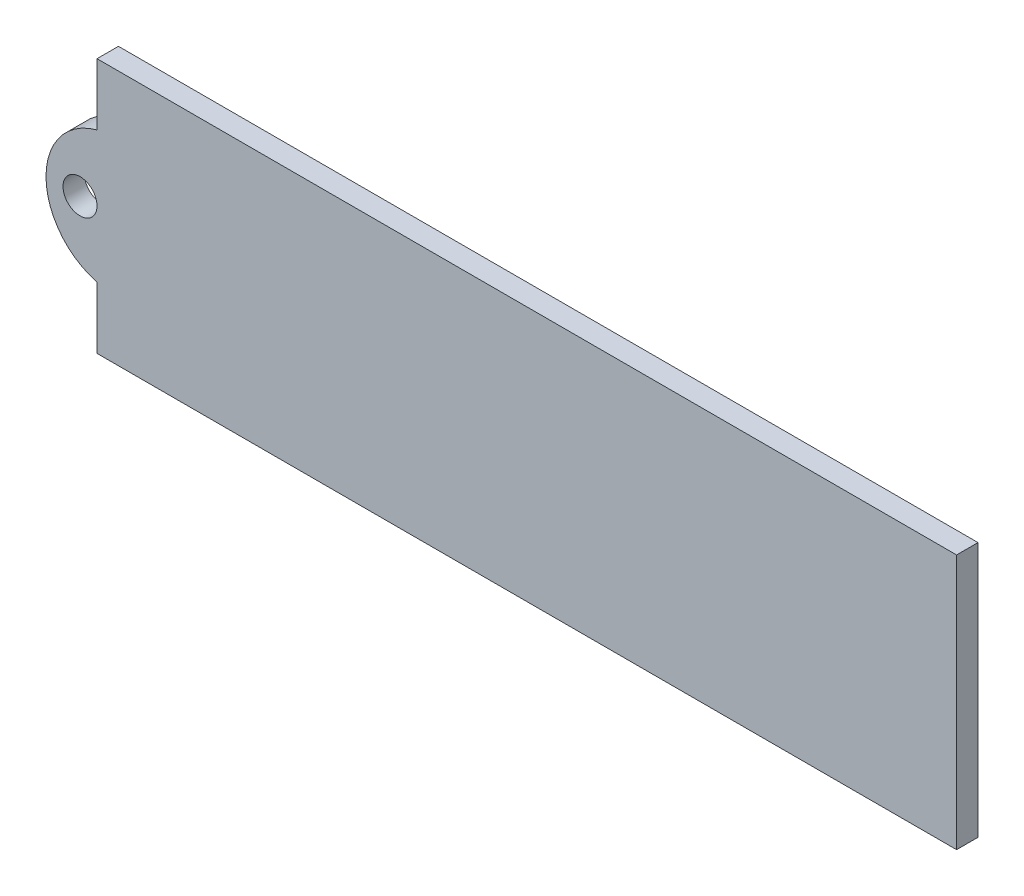
from build123d import *

# Parameters (mm, degrees)
BOSS_EXTRUDE1_DEPTH = 2
CUT_EXTRUDE1_DEPTH  = 2.54


with BuildPart() as part:
    # Sketch2 → Boss-Extrude1 (new body)
    with BuildSketch(Plane.XY):
        with BuildLine():
            Line((-40.11295, 11.9126), (-40.11295, 6.148361062))
            ThreePointArc((-40.11295, 6.148361062), (-44.87545, 0), (-40.11295, -6.148361062))
            Line((-40.11295, -6.148361062), (-40.11295, -11.9126))
            Line((-40.11295, -11.9126), (40.11295, -11.9126))
            Line((40.11295, -11.9126), (40.11295, 11.9126))
            Line((40.11295, 11.9126), (-40.11295, 11.9126))
        make_face()
    extrude(amount=BOSS_EXTRUDE1_DEPTH)

    # Sketch5 → Cut-Extrude1 (cut)
    with BuildSketch(Plane(origin=(0, 0, 0), x_dir=(-1, 0, 0), z_dir=(0, 0, -1))):
        with BuildLine():
            ThreePointArc((41.70045, -1.5875), (42.494200012, -1.374815321), (43.075265343, -0.793749976))
            ThreePointArc((43.075265343, -0.793749976), (43.233857253, -0.41087522), (43.28795, 0))
            ThreePointArc((43.28795, 0), (43.233857248, 0.410875237), (43.075265325, 0.793750006))
            ThreePointArc((43.075265325, 0.793750006), (42.494199997, 1.37481533), (41.70045, 1.5875))
            ThreePointArc((41.70045, 1.5875), (40.90670002, 1.37481534), (40.325634695, 0.793750041))
            ThreePointArc((40.325634695, 0.793750041), (40.11295, 1.12e-07), (40.325634583, -0.793749847))
            ThreePointArc((40.325634583, -0.793749847), (40.906699923, -1.374815284), (41.70045, -1.5875))
        make_face()
    extrude(amount=-CUT_EXTRUDE1_DEPTH, mode=Mode.SUBTRACT)


solid = part.part
